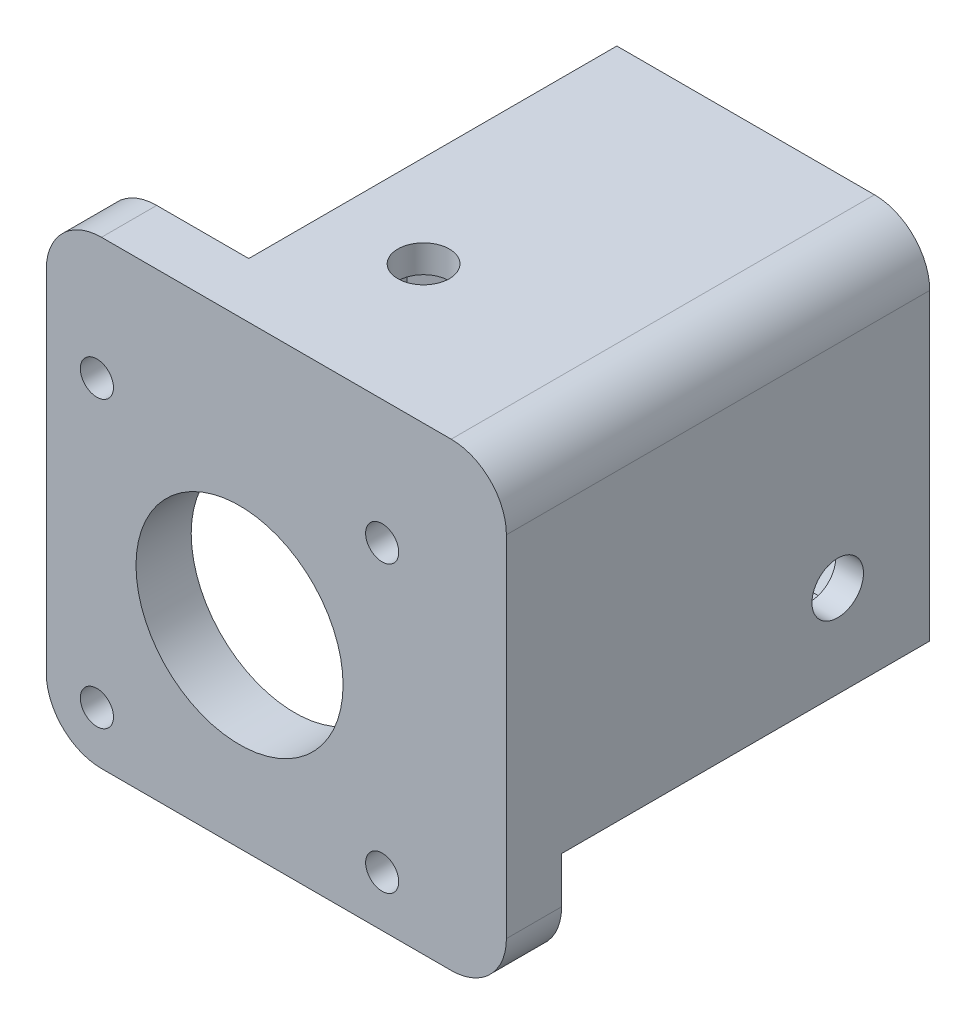
from build123d import *

# Parameters (mm, degrees)
SKETCH1_W              = 50
SKETCH1_H              = 50
BOSS_EXTRUDE1_DEPTH    = 6
BOSS_EXTRUDE2_DEPTH    = 40
F_3_6MM_DOWEL_HOLE1_D  = 3.6
F_22_5MM_DOWEL_HOLE1_D = 22.5
F_5_6MM_DOWEL_HOLE1_D  = 5.6
F_5_6MM_DOWEL_HOLE2_D  = 5.6
CUT_EXTRUDE1_DEPTH     = 3
CUT_EXTRUDE2_DEPTH     = 3
FILLET1_R              = 6
FILLET1_OF_MIRROR2_R   = 6


with BuildPart() as part:
    # Sketch1 → Boss-Extrude1 (new body)
    with BuildSketch(Plane.XY):
        with Locations((-25, 25)):
            Rectangle(SKETCH1_W, SKETCH1_H)
    boss_extrude1 = extrude(amount=-BOSS_EXTRUDE1_DEPTH)

    # Sketch2 → Boss-Extrude2 (add)
    with BuildSketch(Plane(origin=(0, 0, -6), x_dir=(-1, 0, 0), z_dir=(0, 0, -1))):
        Polygon((0, 39), (6, 39), (6, 6), (34, 6), (34, 0), (6, 0), (0, 0), align=None)
    boss_extrude2 = extrude(amount=BOSS_EXTRUDE2_DEPTH)

    # Ø3.6mm Dowel Hole1 (through all)
    with Locations(Plane.XY):
        with Locations((-44.5, 44.5), (-13.5, 44.5), (-13.5, 13.5), (-44.5, 13.5)):
            f_3_6mm_dowel_hole1 = Hole(F_3_6MM_DOWEL_HOLE1_D / 2)

    # Ø22.5mm Dowel Hole1 (through all)
    with Locations(Plane.XY):
        with Locations((-29, 29)):
            f_22_5mm_dowel_hole1 = Hole(F_22_5MM_DOWEL_HOLE1_D / 2)

    # Ø5.6mm Dowel Hole1 (through all)
    with Locations(Plane(origin=(0, 29, -36), x_dir=(0, 0, 1), z_dir=(1, 0, 0))):
        with Locations((0, 0)):
            f_5_6mm_dowel_hole1 = Hole(F_5_6MM_DOWEL_HOLE1_D / 2)

    # Ø5.6mm Dowel Hole2 (through all)
    with Locations(Plane(origin=(0, 0, 0), x_dir=(-1, 0, 0), z_dir=(0, -1, 0))):
        with Locations((24, 15)):
            f_5_6mm_dowel_hole2 = Hole(F_5_6MM_DOWEL_HOLE2_D / 2)

    # Sketch12 → Cut-Extrude1 (cut)
    with BuildSketch(Plane(origin=(0, 6, 0), x_dir=(1, 0, 0), z_dir=(0, 1, 0))):
        Polygon((-28.2, 12.575128869), (-24, 10.150257739), (-19.8, 12.575128869), (-19.8, 17.424871131), (-24, 19.849742261), (-28.2, 17.424871131), align=None)
    cut_extrude1 = extrude(amount=-CUT_EXTRUDE1_DEPTH, mode=Mode.SUBTRACT)

    # Sketch13 → Cut-Extrude2 (cut)
    with BuildSketch(Plane.ZY.offset(6)):
        Polygon((-40.849742261, 29), (-38.424871131, 24.8), (-33.575128869, 24.8), (-31.150257739, 29), (-33.575128869, 33.2), (-38.424871131, 33.2), align=None)
    cut_extrude2 = extrude(amount=-CUT_EXTRUDE2_DEPTH, mode=Mode.SUBTRACT)

    # Fillet1
    fillet1_edges = [part.edges().sort_by_distance(p)[0] for p in [
        (-50, 50, -3),
        (0, 50, -3),
        (0, 0, -23),
        (-50, 0, -3),
    ]]
    fillet(fillet1_edges, radius=FILLET1_R)


with BuildPart() as mirror2_1:
    # Mirror2: Boss-Extrude1, Boss-Extrude2 across plane
    add(boss_extrude1.mirror(Plane.ZX))
    add(boss_extrude2.mirror(Plane.ZX))

    # Mirror2 2: Ø3.6mm Dowel Hole1, Ø22.5mm Dowel Hole1, Ø5.6mm Dowel Hole1, Ø5.6mm Dowel Hole2, Cut-Extrude1, Cut-Extrude2 across plane
    add(f_3_6mm_dowel_hole1.mirror(Plane.ZX), mode=Mode.SUBTRACT)
    add(f_22_5mm_dowel_hole1.mirror(Plane.ZX), mode=Mode.SUBTRACT)
    add(f_5_6mm_dowel_hole1.mirror(Plane.ZX), mode=Mode.SUBTRACT)
    add(f_5_6mm_dowel_hole2.mirror(Plane.ZX), mode=Mode.SUBTRACT)
    add(cut_extrude1.mirror(Plane.ZX), mode=Mode.SUBTRACT)
    add(cut_extrude2.mirror(Plane.ZX), mode=Mode.SUBTRACT)

    # Fillet1 of Mirror2
    fillet1_of_mirror2_edges = [mirror2_1.edges().sort_by_distance(p)[0] for p in [
        (-50, -50, -3),
        (0, -50, -3),
        (0, 0, -23),
        (-50, 0, -3),
    ]]
    fillet(fillet1_of_mirror2_edges, radius=FILLET1_OF_MIRROR2_R)


with BuildPart() as part_1:
    add(part.part)

    # Mirror2 united with what the copies touc: union Mirror2_1
    add(mirror2_1.part)

    # Split1
    split(bisect_by=Plane.ZX, keep=Keep.BOTTOM)


solid = part_1.part
